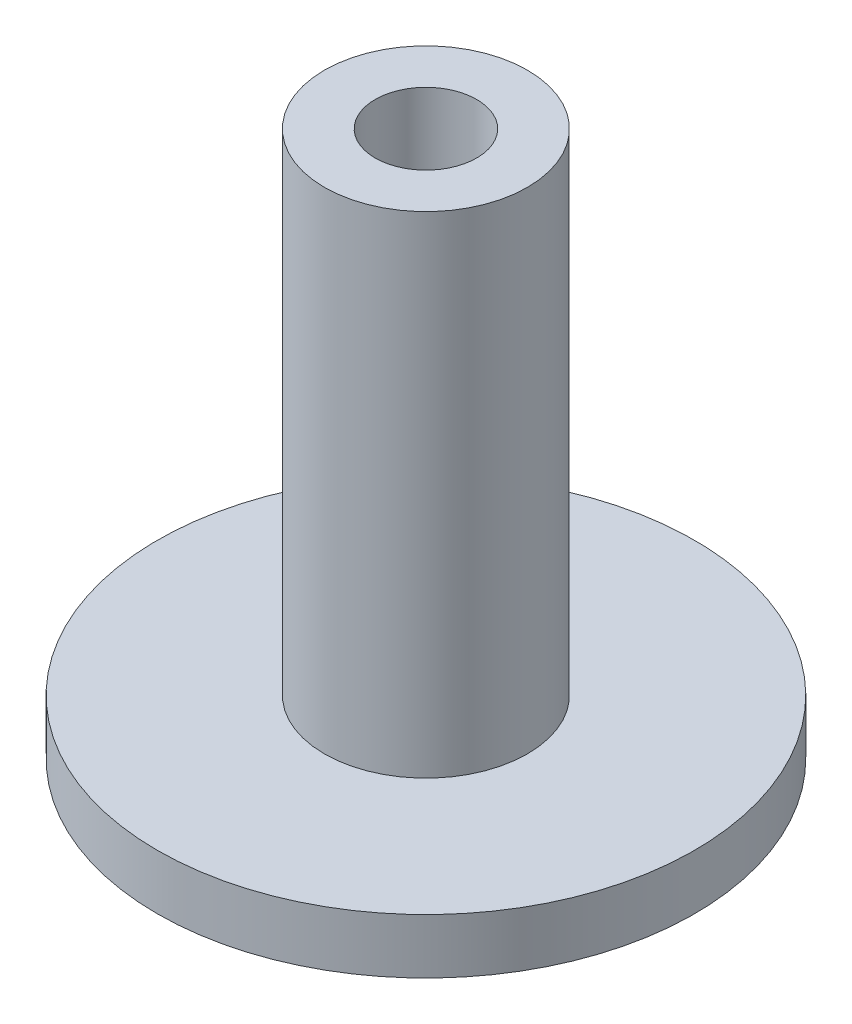
from build123d import *

# Parameters (mm, degrees)
SKETCH1_R           = 6.35
BOSS_EXTRUDE1_DEPTH = 1.3
SKETCH2_R           = 2.4
BOSS_EXTRUDE2_DEPTH = 11.6
SKETCH3_R           = 1.2
CUT_EXTRUDE1_DEPTH  = 16.717983331


with BuildPart() as part:
    # Sketch1 → Boss-Extrude1 (new body)
    with BuildSketch(Plane(origin=(0, 0, 0), x_dir=(1, 0, 0), z_dir=(0, 1, 0))):
        Circle(SKETCH1_R)
    extrude(amount=BOSS_EXTRUDE1_DEPTH)

    # Sketch2 → Boss-Extrude2 (add)
    with BuildSketch(Plane(origin=(0, 1.3, 0), x_dir=(1, 0, 0), z_dir=(0, 1, 0))):
        Circle(SKETCH2_R)
    extrude(amount=BOSS_EXTRUDE2_DEPTH)

    # Sketch3 → Cut-Extrude1 (cut, through all)
    with BuildSketch(Plane(origin=(0, 12.9, 0), x_dir=(1, 0, 0), z_dir=(0, 1, 0))):
        Circle(SKETCH3_R)
    extrude(amount=-CUT_EXTRUDE1_DEPTH, mode=Mode.SUBTRACT)


solid = part.part
